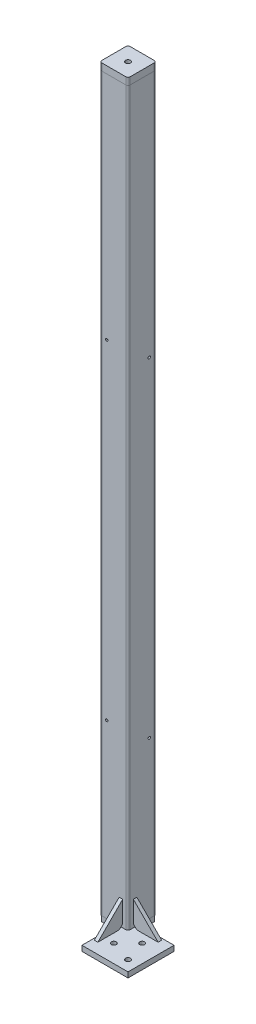
from build123d import *

# Parameters (mm, degrees)
MEMBER_1_DEPTH                   = 2065
EXTRUDE_1_DEPTH                  = 15
HOLE_WIZARD_14_0_14_1_AT_2_COUNT = 2
HOLE_WIZARD_14_0_14_1_AT_2_PITCH = 63.245553203
HOLE_WIZARD_14_0_14_1_AT_3_COUNT = 2
HOLE_WIZARD_14_0_14_1_AT_3_PITCH = 63.245553203
EXTRUDE_2_DEPTH                  = 10
EXTRUDE_3_DEPTH                  = 10
CHAMFER_1_SIZE                   = 5
EXTRUDE_6_DEPTH                  = 20
HOLE_START                       = 36
HOLE_WIZARD_M8_1_OUTLINE_R       = 3.4
HOLE_WIZARD_M8_1_DEPTH           = 4
HOLE_WIZARD_M8_2_OUTLINE_R       = 3.4
HOLE_WIZARD_M8_2_DEPTH           = 4


# Read off the part's stored shape, not the designer's step: M8 螺纹孔1, M8 螺纹孔2
with BuildPart() as part:
    # Sketch11 → Member 1 (new body)
    with BuildSketch(Plane(origin=(0, 0, 0), x_dir=(-1, 0, 0), z_dir=(0, 1, 0))):
        with BuildLine():
            Line((-34, -40), (34, -40))
            ThreePointArc((34, -40), (38.242640687, -38.242640687), (40, -34))
            Line((40, -34), (40, 34))
            ThreePointArc((40, 34), (38.242640687, 38.242640687), (34, 40))
            Line((34, 40), (-34, 40))
            ThreePointArc((-34, 40), (-38.242640687, 38.242640687), (-40, 34))
            Line((-40, 34), (-40, -34))
            ThreePointArc((-40, -34), (-38.242640687, -38.242640687), (-34, -40))
        make_face()
        with BuildLine():
            Line((-34, -36), (34, -36))
            ThreePointArc((34, -36), (35.414213562, -35.414213562), (36, -34))
            Line((36, -34), (36, 34))
            ThreePointArc((36, 34), (35.414213562, 35.414213562), (34, 36))
            Line((34, 36), (-34, 36))
            ThreePointArc((-34, 36), (-35.414213562, 35.414213562), (-36, 34))
            Line((-36, 34), (-36, -34))
            ThreePointArc((-36, -34), (-35.414213562, -35.414213562), (-34, -36))
        make_face(mode=Mode.SUBTRACT)
    extrude(amount=MEMBER_1_DEPTH)

    # M8 螺纹孔1 outline → M8 螺纹孔1 (cut)
    with BuildSketch(Plane.XY.offset(HOLE_START)):
        with Locations((-20, 485)):
            Circle(HOLE_WIZARD_M8_1_OUTLINE_R)
        with Locations((-20, 1415)):
            Circle(HOLE_WIZARD_M8_1_OUTLINE_R)
    extrude(amount=HOLE_WIZARD_M8_1_DEPTH, mode=Mode.SUBTRACT)

    # M8 螺纹孔2 outline → M8 螺纹孔2 (cut)
    with BuildSketch(Plane.YZ.offset(HOLE_START)):
        with Locations((441.978336483, -19.999999762)):
            Circle(HOLE_WIZARD_M8_2_OUTLINE_R)
        with Locations((1371.978336483, -19.999999762)):
            Circle(HOLE_WIZARD_M8_2_OUTLINE_R)
    extrude(amount=HOLE_WIZARD_M8_2_DEPTH, mode=Mode.SUBTRACT)


with BuildPart() as body_2:
    # 草图3 → 凸台-拉伸1 (new body)
    with BuildSketch(Plane.XZ):
        Polygon((10, 40), (10, 140), (140, 140), (140, 10), (40, 10), (40, -40), (-40, -40), (-40, 40), align=None)
    extrude(amount=EXTRUDE_1_DEPTH)

    # 草图4 → Ø14.0 (14) 直径孔1 (revolve, cut)
    with BuildSketch(Plane(origin=(110, 0, 110), x_dir=(0, 0, 1), z_dir=(1, 0, 0))):
        Polygon((0, 0), (0, 44.206024333), (7, 40), (7, 0), align=None)
    hole_wizard_14_0_14_1 = revolve(axis=Axis((110, 6.35, 110), (0, -1, 0)), mode=Mode.SUBTRACT)

    # Ø14.0 (14) 直径孔1 at 2: Ø14.0 (14) 直径孔1 ×2
    with Locations(*[Vector(-0.9486832980505139, 0, -0.316227766016838) * (i * HOLE_WIZARD_14_0_14_1_AT_2_PITCH) for i in range(1, HOLE_WIZARD_14_0_14_1_AT_2_COUNT)]):
        add(hole_wizard_14_0_14_1, mode=Mode.SUBTRACT)

    # Ø14.0 (14) 直径孔1 at 3: Ø14.0 (14) 直径孔1 ×2
    with Locations(*[Vector(-0.3162277660168379, 0, -0.9486832980505139) * (i * HOLE_WIZARD_14_0_14_1_AT_3_PITCH) for i in range(1, HOLE_WIZARD_14_0_14_1_AT_3_COUNT)]):
        add(hole_wizard_14_0_14_1, mode=Mode.SUBTRACT)

    # 倒角1
    chamfer_1_edges = [body_2.edges().sort_by_distance(p)[0] for p in [
        (-40, -7.5, 40),
        (40, -7.5, -40),
        (-40, -7.5, -40),
    ]]
    chamfer(chamfer_1_edges, length=CHAMFER_1_SIZE)


with BuildPart() as body_3:
    # 草图6 → 凸台-拉伸2 (new body)
    with BuildSketch(Plane.ZY.offset(-25)):
        Polygon((40, 70), (110, 0), (50, 0), (40, 10), align=None)
    extrude(amount=EXTRUDE_2_DEPTH)


with BuildPart() as body_4:
    # 草图7 → 凸台-拉伸3 (new body)
    with BuildSketch(Plane(origin=(0, 0, 25), x_dir=(-1, 0, 0), z_dir=(0, 0, -1))):
        Polygon((-40, 70), (-40, 10), (-50, 0), (-110, 0), align=None)
    extrude(amount=EXTRUDE_3_DEPTH)


with BuildPart() as body_5:
    # 草图26 → 凸台-拉伸6 (new body)
    with BuildSketch(Plane(origin=(0, 2065, 0), x_dir=(1, 0, 0), z_dir=(0, 1, 0))):
        with BuildLine():
            Line((-34, -40), (34, -40))
            ThreePointArc((34, -40), (38.242640687, -38.242640687), (40, -34))
            Line((40, -34), (40, 34))
            ThreePointArc((40, 34), (38.242640687, 38.242640687), (34, 40))
            Line((34, 40), (-34, 40))
            ThreePointArc((-34, 40), (-38.242640687, 38.242640687), (-40, 34))
            Line((-40, 34), (-40, -34))
            ThreePointArc((-40, -34), (-38.242640687, -38.242640687), (-34, -40))
        make_face()
    extrude(amount=EXTRUDE_6_DEPTH)

    # 草图27 → M16 螺纹孔1 (revolve, cut)
    with BuildSketch(Plane(origin=(0, 2085, 0), x_dir=(0, 0, 1), z_dir=(1, 0, 0))):
        Polygon((0, 0), (0, 46.206024333), (7, 42), (7, 0), align=None)
    revolve(axis=Axis((0, 2091.35, 0), (0, -1, 0)), mode=Mode.SUBTRACT)


solid = Compound([part.part, body_2.part, body_3.part, body_4.part, body_5.part])
